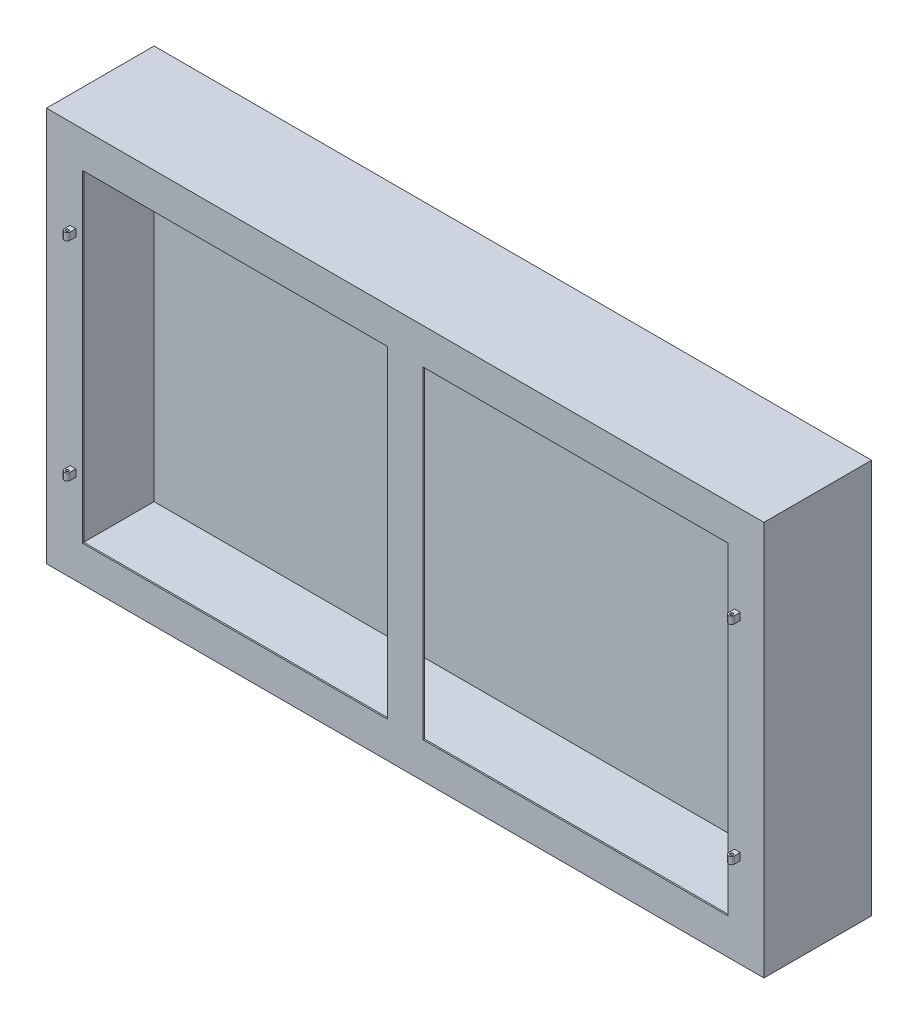
from build123d import *

# Parameters (mm, degrees)
SKETCH1_W               = 1000
SKETCH1_H               = 550
BASE_EXTRUDE_DEPTH      = 150
SKETCH2_W               = 900
SKETCH2_H               = 450
CUT_EXTRUDE1_DEPTH      = 148
SHELL3_START            = -998
SHELL3_OUTLINE_W        = 546
SHELL3_OUTLINE_H        = 146
SHELL3_DEPTH            = 996
SKETCH3_W               = 50
SKETCH3_H               = 450
BOSS_EXTRUDE1_DEPTH     = 2
SKETCH4_R               = 2
BOSS_EXTRUDE2_DEPTH     = 10
MIRROR2_COPY_1_SKETCH_R = 2
MIRROR2_COPY_1_DEPTH    = 10


# Read off the part's stored shape, not the designer's step: Shell3
with BuildPart() as part:
    # Sketch1 → Base-Extrude (new body)
    with BuildSketch(Plane.XY):
        with Locations((-500, 275)):
            Rectangle(SKETCH1_W, SKETCH1_H)
    extrude(amount=BASE_EXTRUDE_DEPTH)

    # Sketch2 → Cut-Extrude1 (cut)
    with BuildSketch(Plane.XY.offset(150)):
        with Locations((-500, 275)):
            Rectangle(SKETCH2_W, SKETCH2_H)
    extrude(amount=-CUT_EXTRUDE1_DEPTH, mode=Mode.SUBTRACT)

    # Shell3 outline → Shell3 (cut)
    with BuildSketch(Plane.YZ.offset(SHELL3_START)):
        with Locations((275, 75)):
            Rectangle(SHELL3_OUTLINE_W, SHELL3_OUTLINE_H)
    extrude(amount=SHELL3_DEPTH, mode=Mode.SUBTRACT)

    # Sketch3 → Boss-Extrude1 (add)
    with BuildSketch(Plane.XY.offset(150)):
        with Locations((-500, 275)):
            Rectangle(SKETCH3_W, SKETCH3_H)
    extrude(amount=-BOSS_EXTRUDE1_DEPTH)

    # Sketch4 → Boss-Extrude2 (add)
    with BuildSketch(Plane.XZ.offset(-125)):
        with BuildLine():
            Line((-41, 150), (-33, 150))
            Line((-33, 150), (-33, 158))
            ThreePointArc((-33, 158), (-37, 162), (-41, 158))
            Line((-41, 158), (-41, 150))
        make_face()
        with Locations((-37, 158)):
            Circle(SKETCH4_R, mode=Mode.SUBTRACT)
    boss_extrude2 = extrude(amount=-BOSS_EXTRUDE2_DEPTH)

    # Mirror1: Boss-Extrude2 across plane
    add(boss_extrude2.mirror(Plane.ZY.offset(500)))

    # Mirror2: Boss-Extrude2 across plane
    add(boss_extrude2.mirror(Plane(origin=(0, 275, 0), x_dir=(0, 0, 1), z_dir=(0, -1, 0))))

    # Mirror2 copy 1 sketch → Mirror2 copy 1 (add)
    with BuildSketch(Plane(origin=(-1000, 425, 0), x_dir=(-1, 0, 0), z_dir=(0, 1, 0))):
        with BuildLine():
            Line((-41, 150), (-33, 150))
            Line((-33, 150), (-33, 158))
            ThreePointArc((-33, 158), (-37, 162), (-41, 158))
            Line((-41, 158), (-41, 150))
        make_face()
        with Locations((-37, 158)):
            Circle(MIRROR2_COPY_1_SKETCH_R, mode=Mode.SUBTRACT)
    extrude(amount=-MIRROR2_COPY_1_DEPTH)


solid = part.part
